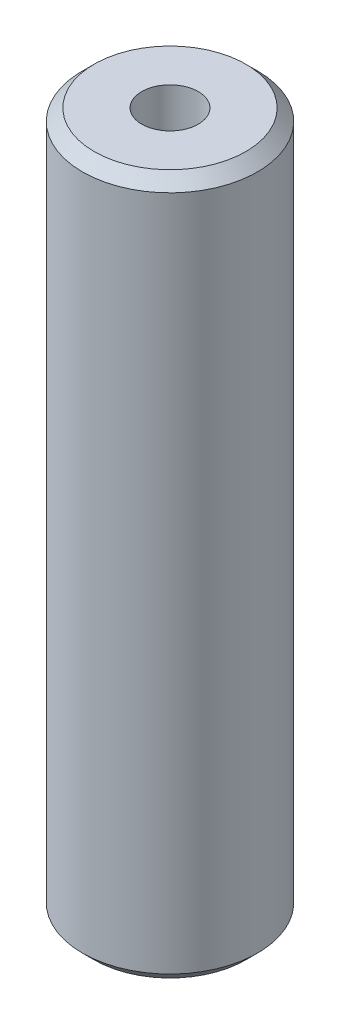
from build123d import *

# Parameters (mm, degrees)
SKETCH1_R           = 25
BOSS_EXTRUDE1_DEPTH = 199.973046098
SKETCH2_R           = 8.08040877
CUT_EXTRUDE1_DEPTH  = 204.074417802
CHAMFER1_SIZE       = 3.348266427


with BuildPart() as part:
    # Sketch1 → Boss-Extrude1 (new body)
    with BuildSketch(Plane(origin=(0, 0, 0), x_dir=(1, 0, 0), z_dir=(0, 1, 0))):
        Circle(SKETCH1_R)
    extrude(amount=BOSS_EXTRUDE1_DEPTH)

    # Sketch2 → Cut-Extrude1 (cut, through all)
    with BuildSketch(Plane(origin=(0, 0, 0), x_dir=(1, 0, 0), z_dir=(0, 1, 0))):
        Circle(SKETCH2_R)
    extrude(amount=CUT_EXTRUDE1_DEPTH, mode=Mode.SUBTRACT)

    # Chamfer1
    chamfer1_edges = [part.edges().sort_by_distance(p)[0] for p in [
        (-25, 199.973046098, 0),
        (-25, 0, 0),
    ]]
    chamfer(chamfer1_edges, length=CHAMFER1_SIZE)


solid = part.part
